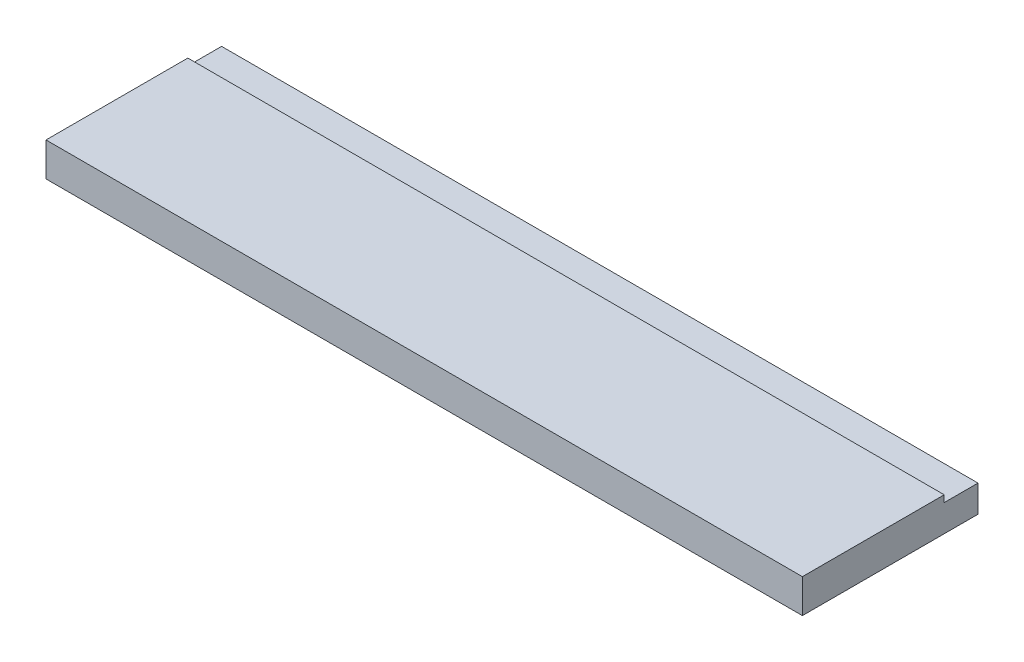
from build123d import *

# Parameters (mm, degrees)
SKETCH_1_W          = 224
SKETCH_1_H          = 52
EXTRUDE_1_DEPTH     = 10
SKETCH_2_W          = 224
SKETCH_2_H          = 10
CUT_EXTRUDE_1_DEPTH = 2


with BuildPart() as part:
    # 草图1 → 凸台-拉伸1 (new body)
    with BuildSketch(Plane(origin=(0, 0, 0), x_dir=(1, 0, 0), z_dir=(0, 1, 0))):
        with Locations((112, 26)):
            Rectangle(SKETCH_1_W, SKETCH_1_H)
    extrude(amount=EXTRUDE_1_DEPTH)

    # 草图2 → 切除-拉伸1 (cut)
    with BuildSketch(Plane(origin=(0, 10, 0), x_dir=(1, 0, 0), z_dir=(0, 1, 0))):
        with Locations((112, 47)):
            Rectangle(SKETCH_2_W, SKETCH_2_H)
    extrude(amount=-CUT_EXTRUDE_1_DEPTH, mode=Mode.SUBTRACT)


solid = part.part
